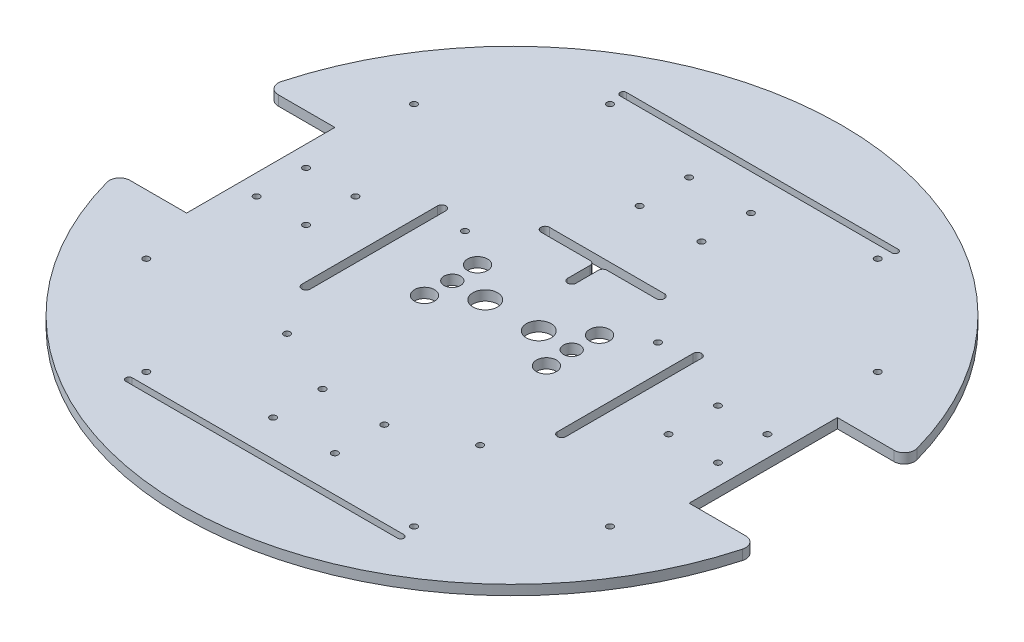
from build123d import *

# Parameters (mm, degrees)
SKETCH_1_R               = 160
EXTRUDE_1_DEPTH          = 4.8
CUT_EXTRUDE_1_DEPTH      = 227.325075942
CUT_EXTRUDE_1_DEPTH_BACK = 227.325075942
SKETCH_2_R               = 1.55
SKETCH_2_R_2             = 6
SKETCH_2_R_3             = 4
SKETCH_2_W               = 40
SKETCH_2_H               = 72
SKETCH_2_W_2             = 35
SKETCH_2_H_2             = 3.05
CUT_EXTRUDE_6_DEPTH      = 224.443594672
CUT_EXTRUDE_6_DEPTH_BACK = 224.443594672
SKETCH_3_W               = 4.1
SKETCH_3_H               = 70
FILLET_3_R               = 2.05
FILLET_6_R               = 2.05
FILLET_7_R               = 1.5
FILLET_8_R               = 5
SKETCH_4_R               = 4.866479959
SKETCH_4_R_2             = 1.55
SKETCH_4_W               = 21.672876589
SKETCH_4_H               = 3.05
CUT_EXTRUDE_7_DEPTH      = 10


with BuildPart() as part:
    # 草图1 → 凸台-拉伸1 (new body)
    with BuildSketch(Plane(origin=(0, 0, 0), x_dir=(1, 0, 0), z_dir=(0, 1, 0))):
        with Locations(Location((0, 0, 0), (0, 0, 270))):
            Circle(SKETCH_1_R)
    extrude(amount=EXTRUDE_1_DEPTH)

    # 草图2 → 切除-拉伸1 (cut, two sides: drawn at the far end of the back side and taken through both)
    with BuildSketch(Plane(origin=(0, 0, 0), x_dir=(1, 0, 0), z_dir=(0, 1, 0)).offset(-CUT_EXTRUDE_1_DEPTH_BACK)):
        with Locations(Location((112, 12, 0), (0, 0, 270))):
            Circle(SKETCH_2_R)
        with Locations(Location((112, -12, 0), (0, 0, 270))):
            Circle(SKETCH_2_R)
        with Locations(Location((88, 12, 0), (0, 0, 270))):
            Circle(SKETCH_2_R)
        with Locations(Location((88, -12, 0), (0, 0, 270))):
            Circle(SKETCH_2_R)
        with Locations(Location((13, 0, 0), (0, 0, 270))):
            Circle(SKETCH_2_R_2)
        with Locations(Location((29, 0, 0), (0, 0, 270))):
            Circle(SKETCH_2_R_3)
        with Locations(Location((46.86, 24, 0), (0, 0, 270))):
            Circle(SKETCH_2_R)
        with Locations(Location((46.86, -62.36, 0), (0, 0, 270))):
            Circle(SKETCH_2_R)
        with Locations(Location((-15, -101, 0), (0, 0, 270))):
            Circle(SKETCH_2_R)
        with Locations(Location((15, -101, 0), (0, 0, 270))):
            Circle(SKETCH_2_R)
        with Locations(Location((-15, -77, 0), (0, 0, 270))):
            Circle(SKETCH_2_R)
        with Locations(Location((15, -77, 0), (0, 0, 270))):
            Circle(SKETCH_2_R)
        with Locations(Location((-46.86, -62.36, 0), (0, 0, 270))):
            Circle(SKETCH_2_R)
        with Locations(Location((-46.86, 24, 0), (0, 0, 270))):
            Circle(SKETCH_2_R)
        with Locations(Location((-29, 0, 0), (0, 0, 270))):
            Circle(SKETCH_2_R_3)
        with Locations(Location((-13, 0, 0), (0, 0, 270))):
            Circle(SKETCH_2_R_2)
        with Locations(Location((-88, -12, 0), (0, 0, 270))):
            Circle(SKETCH_2_R)
        with Locations(Location((-88, 12, 0), (0, 0, 270))):
            Circle(SKETCH_2_R)
        with Locations(Location((-112, -12, 0), (0, 0, 270))):
            Circle(SKETCH_2_R)
        with Locations(Location((-112, 12, 0), (0, 0, 270))):
            Circle(SKETCH_2_R)
        with Locations(Location((15, 77, 0), (0, 0, 270))):
            Circle(SKETCH_2_R)
        with Locations(Location((-15, 77, 0), (0, 0, 270))):
            Circle(SKETCH_2_R)
        with Locations(Location((15, 101, 0), (0, 0, 270))):
            Circle(SKETCH_2_R)
        with Locations(Location((-15, 101, 0), (0, 0, 270))):
            Circle(SKETCH_2_R)
        with Locations((142, 0)):
            Rectangle(SKETCH_2_W, SKETCH_2_H)
        with Locations((-142, 0)):
            Rectangle(SKETCH_2_W, SKETCH_2_H)
        with Locations((-50, -120)):
            Rectangle(SKETCH_2_W_2, SKETCH_2_H_2)
        with Locations((0, -120)):
            Rectangle(SKETCH_2_W_2, SKETCH_2_H_2)
        with Locations((50, -120)):
            Rectangle(SKETCH_2_W_2, SKETCH_2_H_2)
        with Locations((50, 120)):
            Rectangle(SKETCH_2_W_2, SKETCH_2_H_2)
        with Locations((0, 120)):
            Rectangle(SKETCH_2_W_2, SKETCH_2_H_2)
        with Locations((-50, 120)):
            Rectangle(SKETCH_2_W_2, SKETCH_2_H_2)
    extrude(amount=CUT_EXTRUDE_1_DEPTH + CUT_EXTRUDE_1_DEPTH_BACK, mode=Mode.SUBTRACT)

    # 草图3 → 切除-拉伸6 (cut, two sides: drawn at the far end of the back side and taken through both)
    with BuildSketch(Plane(origin=(0, 0, 0), x_dir=(1, 0, 0), z_dir=(0, 1, 0)).offset(-CUT_EXTRUDE_6_DEPTH_BACK)):
        Polygon((-30, 46.1), (30, 46.1), (30, 42), (2.05, 42), (2.05, 27), (-2.05, 27), (-2.05, 42), (-30, 42), align=None)
        with Locations((-62.05, -5)):
            Rectangle(SKETCH_3_W, SKETCH_3_H)
        with Locations((62.05, -5)):
            Rectangle(SKETCH_3_W, SKETCH_3_H)
    extrude(amount=CUT_EXTRUDE_6_DEPTH + CUT_EXTRUDE_6_DEPTH_BACK, mode=Mode.SUBTRACT)

    # 圆角3
    fillet_3_edges = [part.edges().sort_by_distance(p)[0] for p in [
        (2.05, 2.4, -27),
        (-2.05, 2.4, -27),
        (30, 2.4, -42),
        (30, 2.4, -46.1),
        (2.05, 2.4, -42),
        (-2.05, 2.4, -42),
        (-30, 2.4, -42),
        (-30, 2.4, -46.1),
    ]]
    fillet(fillet_3_edges, radius=FILLET_3_R - 0.0001)  # a hair under: the kernel refuses the full size

    # 圆角6
    fillet_6_edges = [part.edges().sort_by_distance(p)[0] for p in [
        (60, 2.4, 40),
        (64.1, 2.4, 40),
        (64.1, 2.4, -30),
        (60, 2.4, -30),
        (-60, 2.4, -30),
        (-60, 2.4, 40),
        (-64.1, 2.4, 40),
        (-64.1, 2.4, -30),
    ]]
    fillet(fillet_6_edges, radius=FILLET_6_R - 0.0001)  # a hair under: the kernel refuses the full size

    # 圆角7
    fillet_7_edges = [part.edges().sort_by_distance(p)[0] for p in [
        (17.5, 2.4, 118.475),
        (17.5, 2.4, 121.525),
        (-17.5, 2.4, 121.525),
        (-17.5, 2.4, 118.475),
        (32.5, 2.4, 121.525),
        (32.5, 2.4, 118.475),
        (67.5, 2.4, 118.475),
        (67.5, 2.4, 121.525),
        (32.5, 2.4, -121.525),
        (67.5, 2.4, -121.525),
        (67.5, 2.4, -118.475),
        (32.5, 2.4, -118.475),
        (-17.5, 2.4, -121.525),
        (17.5, 2.4, -121.525),
        (17.5, 2.4, -118.475),
        (-17.5, 2.4, -118.475),
        (-67.5, 2.4, -121.525),
        (-32.5, 2.4, -121.525),
        (-32.5, 2.4, -118.475),
        (-67.5, 2.4, -118.475),
        (-32.5, 2.4, 118.475),
        (-32.5, 2.4, 121.525),
        (-67.5, 2.4, 121.525),
        (-67.5, 2.4, 118.475),
    ]]
    fillet(fillet_7_edges, radius=FILLET_7_R)

    # 圆角8
    fillet_8_edges = [part.edges().sort_by_distance(p)[0] for p in [
        (155.897402159, 2.4, -36),
        (155.897402159, 2.4, 36),
        (-155.897402159, 2.4, -36),
        (-155.897402159, 2.4, 36),
    ]]
    fillet(fillet_8_edges, radius=FILLET_8_R)

    # 草图4 → 切除-拉伸7 (cut)
    with BuildSketch(Plane(origin=(0, 4.8, 0), x_dir=(1, 0, 0), z_dir=(0, 1, 0))):
        with Locations(Location((29.614190954, 12.88707557, 0), (0, 0, 270))):
            Circle(SKETCH_4_R)
        with Locations(Location((112.583302492, 65, 0), (0, 0, 270))):
            Circle(SKETCH_4_R_2)
        with Locations(Location((65, 112.583302492, 0), (0, 0, 270))):
            Circle(SKETCH_4_R_2)
        with Locations(Location((65, -112.583302492, 0), (0, 0, 270))):
            Circle(SKETCH_4_R_2)
        with Locations(Location((112.583302492, -65, 0), (0, 0, 270))):
            Circle(SKETCH_4_R_2)
        with Locations(Location((29.614190954, -12.88707557, 0), (0, 0, 270))):
            Circle(SKETCH_4_R)
        with Locations(Location((-29.614190954, -12.88707557, 0), (0, 0, 270))):
            Circle(SKETCH_4_R)
        with Locations(Location((-112.583302492, -65, 0), (0, 0, 270))):
            Circle(SKETCH_4_R_2)
        with Locations(Location((-65, -112.583302492, 0), (0, 0, 270))):
            Circle(SKETCH_4_R_2)
        with Locations(Location((-65, 112.583302492, 0), (0, 0, 270))):
            Circle(SKETCH_4_R_2)
        with Locations(Location((-112.583302492, 65, 0), (0, 0, 270))):
            Circle(SKETCH_4_R_2)
        with Locations(Location((-29.614190954, 12.88707557, 0), (0, 0, 270))):
            Circle(SKETCH_4_R)
        with Locations((25.940224634, 120)):
            Rectangle(SKETCH_4_W, SKETCH_4_H)
        with Locations((25.940224634, -120)):
            Rectangle(SKETCH_4_W, SKETCH_4_H)
        with Locations((-25.940224634, -120)):
            Rectangle(SKETCH_4_W, SKETCH_4_H)
        with Locations((-25.940224634, 120)):
            Rectangle(SKETCH_4_W, SKETCH_4_H)
    extrude(amount=-CUT_EXTRUDE_7_DEPTH, mode=Mode.SUBTRACT)


solid = part.part
